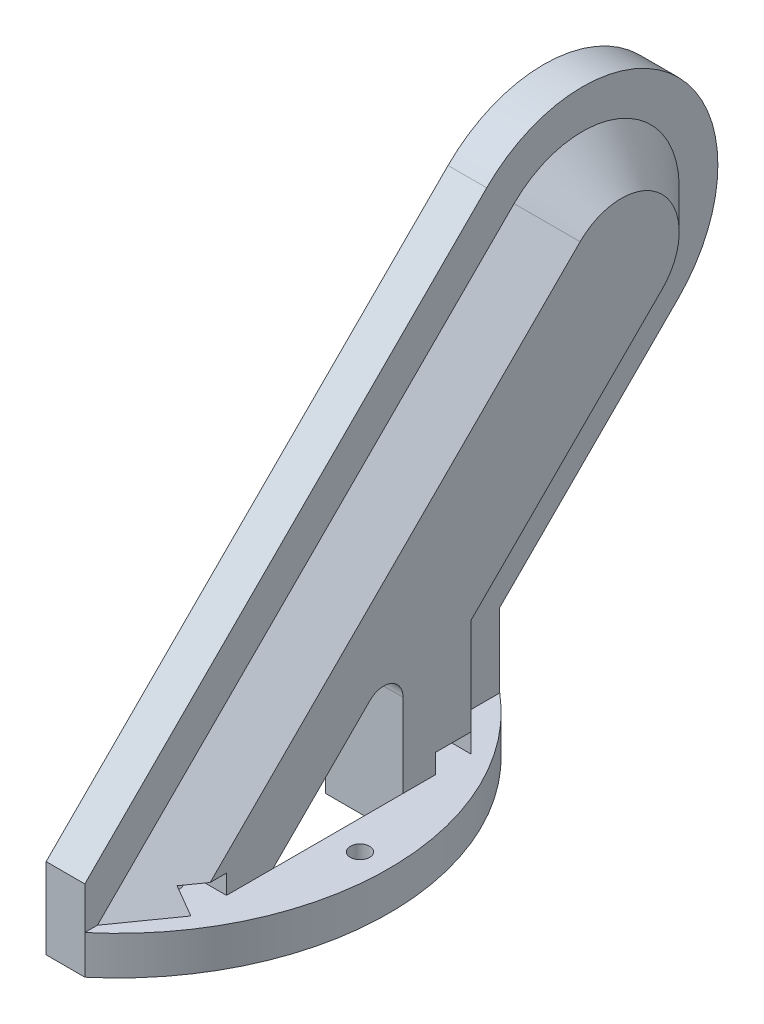
from build123d import *

# Parameters (mm, degrees)
BOSS_EXTRUDE3_DEPTH = 10
SKETCH4_R           = 35
SKETCH4_R_2         = 4
BOSS_EXTRUDE4_DEPTH = 10
BOSS_EXTRUDE6_DEPTH = 10
CHAMFER2_SIZE       = 30
CHAMFER2_SIZE2      = 42.426406871
CHAMFER3_SIZE       = 10
CUT_EXTRUDE1_DEPTH  = 20
SKETCH8_R           = 2.5
CUT_EXTRUDE2_DEPTH  = 20
CUT_EXTRUDE4_START  = -10
SKETCH9_R           = 2.5
CUT_EXTRUDE4_DEPTH  = 5
SKETCH10_R          = 11
CUT_EXTRUDE5_DEPTH  = 5


with BuildPart() as part:
    # Sketch3 → Boss-Extrude3 (new body)
    with BuildSketch(Plane(origin=(0, 0, 0), x_dir=(1, 0, 0), z_dir=(0, 1, 0))):
        with BuildLine():
            Line((45, 53.619026474), (35, 53.619026474))
            Line((35, 53.619026474), (35, -53.619026474))
            Line((35, -53.619026474), (45, -53.619026474))
            ThreePointArc((45, -53.619026474), (70, 0), (45, 53.619026474))
        make_face()
    extrude(amount=BOSS_EXTRUDE3_DEPTH)

    # Sketch4 → Boss-Extrude4 (add)
    # profile 1 of 2: a face of its own
    with BuildSketch(Plane.ZY.offset(-35)):
        with BuildLine():
            Line((-53.619026474, 29.121551791), (-53.619026474, 10))
            Line((-53.619026474, 10), (53.619026474, 10))
            Line((53.619026474, 10), (53.619026474, 20.878448209))
            Line((53.619026474, 20.878448209), (-50.251262658, 124.748737342))
            ThreePointArc((-50.251262658, 124.748737342), (-42.664216362, 113.393920133), (-40, 100))
            ThreePointArc((-40, 100), (-61.606079867, 67.664216362), (-99.748737342, 75.251262658))
            Line((-99.748737342, 75.251262658), (-53.619026474, 29.121551791))
        make_face()
    # profile 2 of 2: a face of its own
    with BuildSketch(Plane.ZY.offset(-35)):
        with Locations((-75, 100)):
            Circle(SKETCH4_R)
        with Locations((-75, 100)):
            Circle(SKETCH4_R_2, mode=Mode.SUBTRACT)
    extrude(amount=-BOSS_EXTRUDE4_DEPTH)

    # Sketch6 → Boss-Extrude6 (add)
    with BuildSketch(Plane(origin=(45, 0, 0), x_dir=(0, 0, -1), z_dir=(1, 0, 0))):
        with BuildLine():
            Line((64.393398282, 110.606601718), (-36.213203436, 10))
            Line((-36.213203436, 10), (6.213203436, 10))
            Line((6.213203436, 10), (85.606601718, 89.393398282))
            ThreePointArc((85.606601718, 89.393398282), (85.606601718, 110.606601718), (64.393398282, 110.606601718))
        make_face()
    extrude(amount=BOSS_EXTRUDE6_DEPTH)

    # Chamfer2
    chamfer2_edges = [part.edges().sort_by_distance(p)[0] for p in [
        (50, 10, -6.213203436),
    ]]
    chamfer2_side = [part.faces().sort_by_distance(p)[0] for p in [
        (56.695914019, 10, -4.424051509),
    ]]
    chamfer(chamfer2_edges, length=CHAMFER2_SIZE, length2=CHAMFER2_SIZE2, reference=chamfer2_side[0])

    # Chamfer3
    chamfer3_edges = [part.edges().sort_by_distance(p)[0] for p in [
        (45, 25, -36.213203436),
        (45, 64.696699141, -60.909902577),
        (45, 110.606601718, -85.606601718),
        (45, 60.303300859, -14.090097423),
    ]]
    chamfer(chamfer3_edges, length=CHAMFER3_SIZE - 0.0001)  # a hair under: the kernel refuses the full size

    # Sketch7 → Cut-Extrude1 (cut)
    with BuildSketch(Plane.ZY.offset(-35)):
        with BuildLine():
            Line((18.619026474, 6.380973526), (18.619026474, 0))
            Line((18.619026474, 0), (-18.619026474, 0))
            Line((-18.619026474, 0), (-18.619026474, 31.547958662))
            ThreePointArc((-18.619026474, 31.547958662), (-15.532443636, 36.167356325), (-10.083492568, 35.083492568))
            Line((-10.083492568, 35.083492568), (18.619026474, 6.380973526))
        make_face()
    extrude(amount=-CUT_EXTRUDE1_DEPTH, mode=Mode.SUBTRACT)

    # Sketch8 → Cut-Extrude2 (cut)
    with BuildSketch(Plane.XZ):
        with Locations(Location((45, 31.622776602, 0), (0, 0, 270))):
            Circle(SKETCH8_R)
        with Locations(Location((45, -31.622776602, 0), (0, 0, 270))):
            Circle(SKETCH8_R)
        with Locations(Location((62.5, 0, 0), (0, 0, 270))):
            Circle(SKETCH8_R)
    extrude(amount=-CUT_EXTRUDE2_DEPTH, mode=Mode.SUBTRACT)

    # Sketch9 → Cut-Extrude4 (cut)
    # profile 1 of 4: a face of its own
    with BuildSketch(Plane.XZ.offset(CUT_EXTRUDE4_START)):
        Polygon((55, 26.997776602), (47.670244995, 26.997776602), (50.34048999, 31.622776602), (47.670244995, 36.247776602), (55, 36.213203436), align=None)
    # profile 2 of 4: a face of its own
    with BuildSketch(Plane.XZ.offset(CUT_EXTRUDE4_START)):
        Polygon((42.329755005, 26.997776602), (47.670244995, 26.997776602), (50.34048999, 31.622776602), (47.670244995, 36.247776602), (42.329755005, 36.247776602), (39.65951001, 31.622776602), align=None)
        with Locations(Location((45, 31.622776602, 0), (0, 0, 270))):
            Circle(SKETCH9_R, mode=Mode.SUBTRACT)
    # profile 3 of 4: a face of its own
    with BuildSketch(Plane.XZ.offset(CUT_EXTRUDE4_START)):
        Polygon((55, -36.213203436), (47.670244995, -36.247776602), (50.34048999, -31.622776602), (47.670244995, -26.997776602), (55, -26.997776602), align=None)
    # profile 4 of 4: a face of its own
    with BuildSketch(Plane.XZ.offset(CUT_EXTRUDE4_START)):
        Polygon((42.329755005, -36.247776602), (47.670244995, -36.247776602), (50.34048999, -31.622776602), (47.670244995, -26.997776602), (42.329755005, -26.997776602), (39.65951001, -31.622776602), align=None)
        with Locations(Location((45, -31.622776602, 0), (0, 0, 270))):
            Circle(SKETCH9_R, mode=Mode.SUBTRACT)
    extrude(amount=-CUT_EXTRUDE4_DEPTH, mode=Mode.SUBTRACT)

    # Sketch10 → Cut-Extrude5 (cut)
    with BuildSketch(Plane.ZY.offset(-35)):
        with Locations((-75, 100)):
            Circle(SKETCH10_R)
    extrude(amount=-CUT_EXTRUDE5_DEPTH, mode=Mode.SUBTRACT)


solid = part.part
